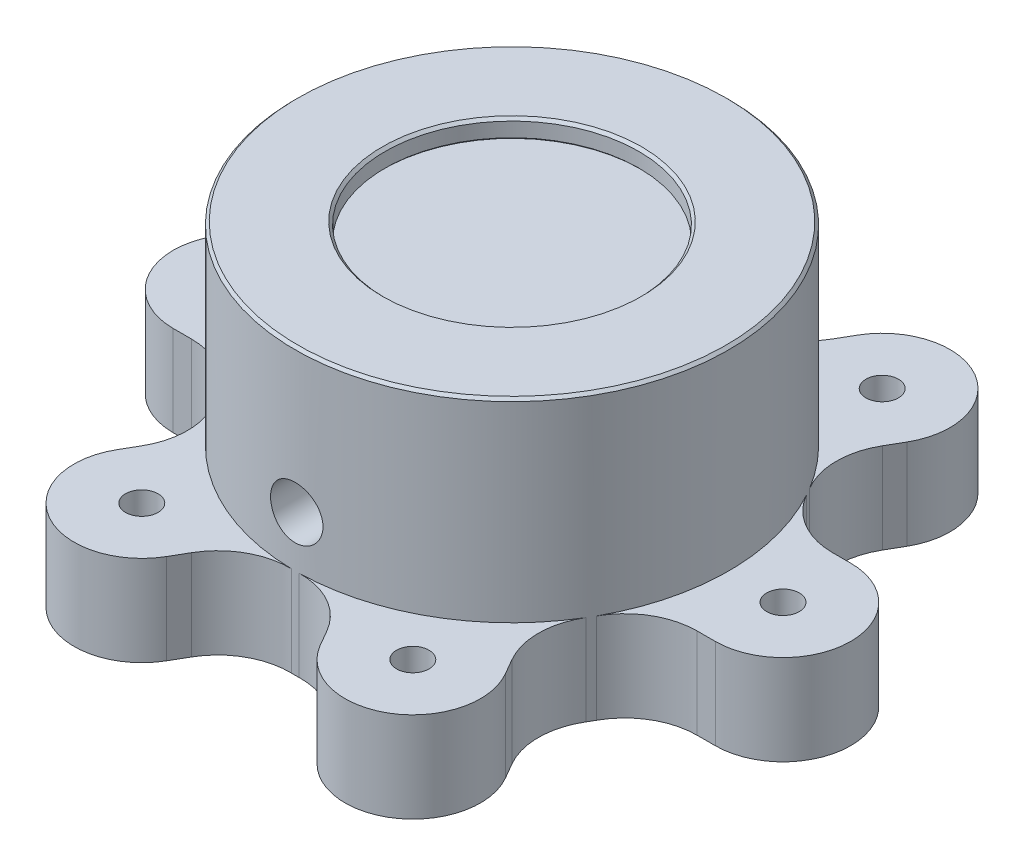
from build123d import *

# Parameters (mm, degrees)
CHAMFER1_SIZE          = 0.3
CUT_EXTRUDE4_START     = 10.66266842
CUT_EXTRUDE4_OUTLINE_R = 2.9
CUT_EXTRUDE4_DEPTH     = 13.33733168
BOSS_EXTRUDE1_START    = -10
SKETCH10_R             = 1.8
BOSS_EXTRUDE1_DEPTH    = 10
FILLET1_R              = 8
SKETCH11_R             = 14.05
BOSS_EXTRUDE2_DEPTH    = 0.1
SKETCH12_R             = 21.35
BOSS_EXTRUDE3_DEPTH    = 0.1
SKETCH13_R             = 14.35
BOSS_EXTRUDE4_DEPTH    = 0.1


# Read off the part's stored shape, not the designer's step: Cut-Extrude4
with BuildPart() as part:
    # Sketch1 → Revolve1 (revolve)
    with BuildSketch(Plane.XY, mode=Mode.PRIVATE) as revolve1_sk:
        Polygon((-14.05, 0), (-24, 0), (-24, 31.5), (-14.05, 31.5), (-14.05, 29.3), (-16.3, 29.3), (-16.3, 25.2), (-14.05, 25.2), (-14.05, 23.5), (-14.55, 23.5), (-14.55, 23), (-14.05, 23), (-11.05, 23), (-11.05, 8.5), (-14.05, 8.5), (-14.55, 8.5), (-14.55, 8), (-14.05, 8), (-14.05, 6.3), (-16.6, 6.3), (-16.6, 2.2), (-14.05, 2.2), align=None)
    revolve(revolve1_sk.sketch.rotate(Axis((0, 0, 0), (0, 1, 0)), 270), axis=Axis((0, 0, 0), (0, 1, 0)))

    # Chamfer1
    chamfer1_edges = [part.edges().sort_by_distance(p)[0] for p in [
        (0, 2.2, 16.6),
        (0, 2.2, 14.05),
        (0, 0, 14.05),
        (0, 31.5, 24),
        (0, 31.5, 14.05),
        (0, 29.3, 14.05),
        (0, 29.3, 16.3),
        (0, 25.2, 16.3),
        (0, 25.2, 14.05),
        (0, 23, 11.05),
        (0, 8.5, 11.05),
        (0, 6.3, 16.6),
    ]]
    chamfer(chamfer1_edges, length=CHAMFER1_SIZE)

    # Cut-Extrude4 outline → Cut-Extrude4 (cut)
    with BuildSketch(Plane.XY.offset(CUT_EXTRUDE4_START)):
        with Locations((0, 15.6)):
            Circle(CUT_EXTRUDE4_OUTLINE_R)
    extrude(amount=CUT_EXTRUDE4_DEPTH, mode=Mode.SUBTRACT)

    # Sketch10 → Boss-Extrude1 (add)
    # profile 1 of 6: a face of its own
    with BuildSketch(Plane.XZ.offset(BOSS_EXTRUDE1_START)):
        with BuildLine():
            Line((-30, 7.5), (-22.79802623, 7.5))
            ThreePointArc((-22.79802623, 7.5), (-24, 0), (-22.79802623, -7.5))
            Line((-22.79802623, -7.5), (-30, -7.5))
            ThreePointArc((-30, -7.5), (-37.5, 0), (-30, 7.5))
        make_face()
        with Locations(Location((-30, 0, 0), (0, 0, 270))):
            Circle(SKETCH10_R, mode=Mode.SUBTRACT)
    # profile 2 of 6: a face of its own
    with BuildSketch(Plane.XZ.offset(BOSS_EXTRUDE1_START)):
        with BuildLine():
            Line((-8.504809472, 29.730762114), (-4.903822587, 23.493669872))
            ThreePointArc((-4.903822587, 23.493669872), (-12, 20.784609691), (-17.894203644, 15.993669872))
            Line((-17.894203644, 15.993669872), (-21.495190528, 22.230762114))
            ThreePointArc((-21.495190528, 22.230762114), (-18.75, 32.475952642), (-8.504809472, 29.730762114))
        make_face()
        with Locations(Location((-15, 25.980762114, 0), (0, 0, 270))):
            Circle(SKETCH10_R, mode=Mode.SUBTRACT)
    # profile 3 of 6: a face of its own
    with BuildSketch(Plane.XZ.offset(BOSS_EXTRUDE1_START)):
        with BuildLine():
            Line((21.495190528, 22.230762114), (17.894203644, 15.993669872))
            ThreePointArc((17.894203644, 15.993669872), (12, 20.784609691), (4.903822587, 23.493669872))
            Line((4.903822587, 23.493669872), (8.504809472, 29.730762114))
            ThreePointArc((8.504809472, 29.730762114), (18.75, 32.475952642), (21.495190528, 22.230762114))
        make_face()
        with Locations(Location((15, 25.980762114, 0), (0, 0, 270))):
            Circle(SKETCH10_R, mode=Mode.SUBTRACT)
    # profile 4 of 6: a face of its own
    with BuildSketch(Plane.XZ.offset(BOSS_EXTRUDE1_START)):
        with BuildLine():
            Line((30, -7.5), (22.79802623, -7.5))
            ThreePointArc((22.79802623, -7.5), (24, 0), (22.79802623, 7.5))
            Line((22.79802623, 7.5), (30, 7.5))
            ThreePointArc((30, 7.5), (37.5, 0), (30, -7.5))
        make_face()
        with Locations(Location((30, 0, 0), (0, 0, 270))):
            Circle(SKETCH10_R, mode=Mode.SUBTRACT)
    # profile 5 of 6: a face of its own
    with BuildSketch(Plane.XZ.offset(BOSS_EXTRUDE1_START)):
        with BuildLine():
            Line((8.504809472, -29.730762114), (4.903822587, -23.493669872))
            ThreePointArc((4.903822587, -23.493669872), (12, -20.784609691), (17.894203644, -15.993669872))
            Line((17.894203644, -15.993669872), (21.495190528, -22.230762114))
            ThreePointArc((21.495190528, -22.230762114), (18.75, -32.475952642), (8.504809472, -29.730762114))
        make_face()
        with Locations(Location((15, -25.980762114, 0), (0, 0, 270))):
            Circle(SKETCH10_R, mode=Mode.SUBTRACT)
    # profile 6 of 6: a face of its own
    with BuildSketch(Plane.XZ.offset(BOSS_EXTRUDE1_START)):
        with BuildLine():
            Line((-21.495190528, -22.230762114), (-17.894203644, -15.993669872))
            ThreePointArc((-17.894203644, -15.993669872), (-12, -20.784609691), (-4.903822587, -23.493669872))
            Line((-4.903822587, -23.493669872), (-8.504809472, -29.730762114))
            ThreePointArc((-8.504809472, -29.730762114), (-18.75, -32.475952642), (-21.495190528, -22.230762114))
        make_face()
        with Locations(Location((-15, -25.980762114, 0), (0, 0, 270))):
            Circle(SKETCH10_R, mode=Mode.SUBTRACT)
    extrude(amount=BOSS_EXTRUDE1_DEPTH)

    # Fillet1
    fillet1_edges = [part.edges().sort_by_distance(p)[0] for p in [
        (-4.903822587, 5, 23.493669872),
        (-17.894203644, 5, 15.993669872),
        (17.894203644, 5, 15.993669872),
        (4.903822587, 5, 23.493669872),
        (22.79802623, 5, -7.5),
        (22.79802623, 5, 7.5),
        (4.903822587, 5, -23.493669872),
        (17.894203644, 5, -15.993669872),
        (-17.894203644, 5, -15.993669872),
        (-4.903822587, 5, -23.493669872),
        (-22.79802623, 5, 7.5),
        (-22.79802623, 5, -7.5),
    ]]
    fillet(fillet1_edges, radius=FILLET1_R)

    # Sketch11 → Boss-Extrude2 (add)
    with BuildSketch(Plane.XZ.offset(-6.3)):
        with Locations(Location((0, 0, 0), (0, 0, 270))):
            Circle(SKETCH11_R)
    extrude(amount=-BOSS_EXTRUDE2_DEPTH)

    # Sketch12 → Boss-Extrude3 (add)
    with BuildSketch(Plane.XZ.offset(-8.5)):
        Circle(SKETCH12_R)
    extrude(amount=-BOSS_EXTRUDE3_DEPTH)

    # Sketch13 → Boss-Extrude4 (add)
    with BuildSketch(Plane.XZ.offset(-29.3)):
        Circle(SKETCH13_R)
    extrude(amount=-BOSS_EXTRUDE4_DEPTH)


solid = part.part
